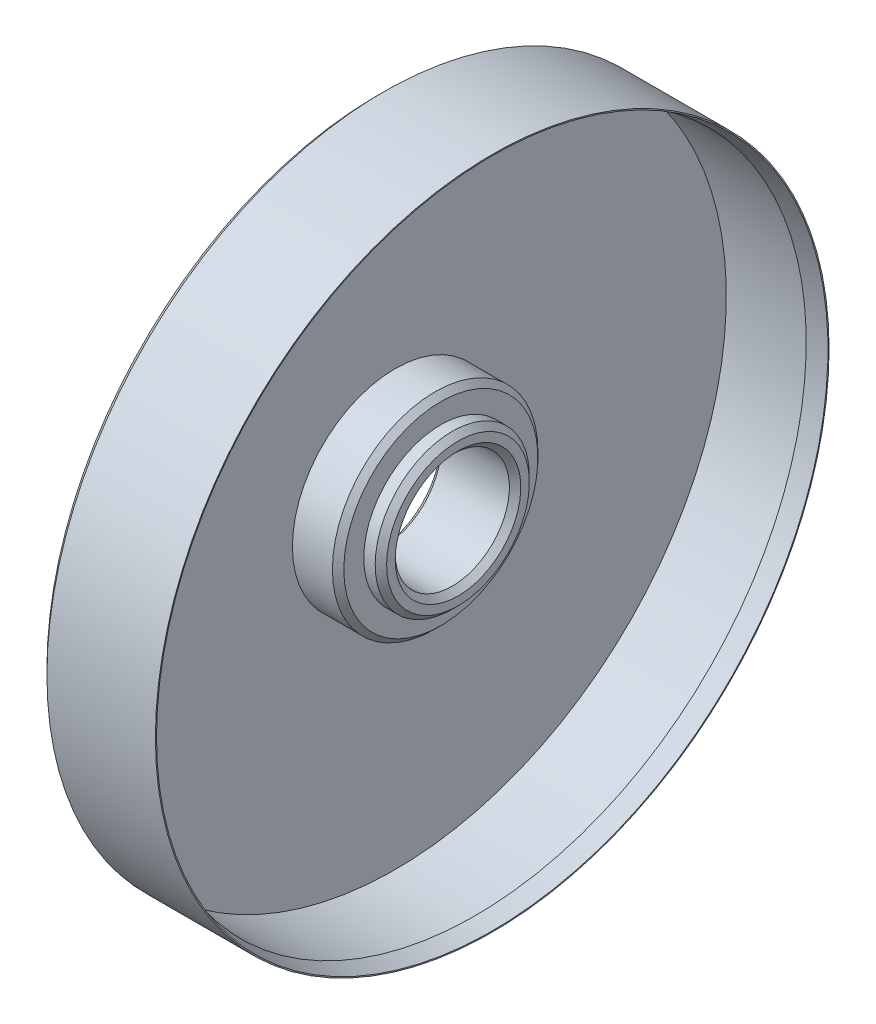
from build123d import *


with BuildPart() as part:
    # Эскиз1 → Повернуть1 (revolve)
    with BuildSketch(Plane.XY):
        Polygon((0, 11), (0, 58), (1, 59), (20, 59), (20, 58.803847577), (17, 58), (3, 58), (3, 18), (10, 18), (11, 17), (11, 13.5), (13, 13.5), (14, 12.5), (14, 11), (13, 10), (1, 10), align=None)
    revolve(axis=Axis((0, 0, 0), (1, 0, 0)))


solid = part.part
